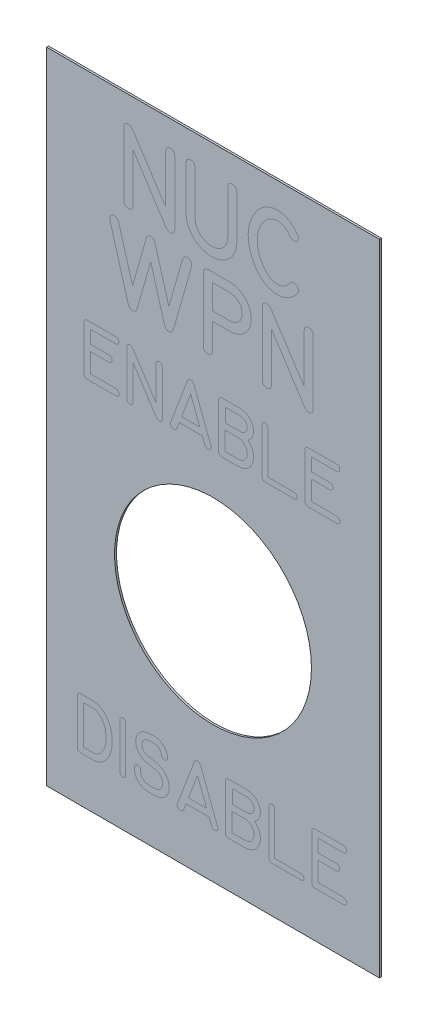
from build123d import *

# Parameters (mm, degrees)
SKETCH1_W           = 21.472242272
SKETCH1_H           = 41.275
SKETCH1_R           = 6.35
BOSS_EXTRUDE1_DEPTH = 0.127


with BuildPart() as part:
    # Sketch1 → Boss-Extrude1 (new body)
    with BuildSketch(Plane.XY):
        with Locations((-22.225, -32.595454384)):
            Rectangle(SKETCH1_W, SKETCH1_H)
        with Locations((-22.225, -38.1)):
            Circle(SKETCH1_R, mode=Mode.SUBTRACT)
    extrude(amount=BOSS_EXTRUDE1_DEPTH)


solid = part.part
